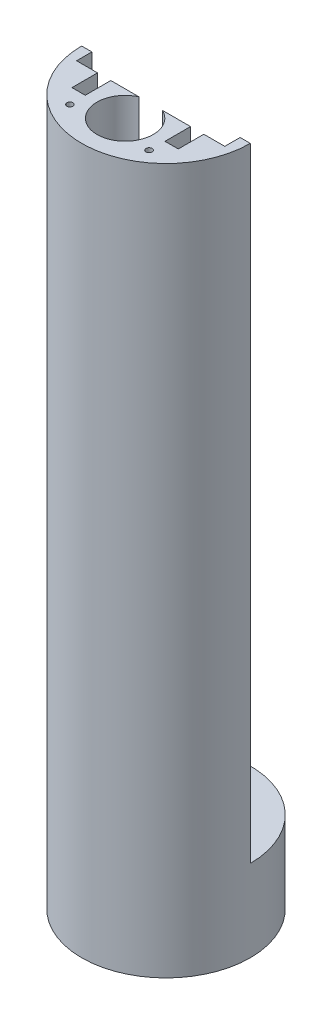
from build123d import *

# Parameters (mm, degrees)
SKETCH_1_R          = 16.5
EXTRUDE_1_DEPTH     = 6
SKETCH_2_R          = 4.25
CUT_EXTRUDE_1_DEPTH = 25.093567606
SKETCH_3_R          = 0.6
CUT_EXTRUDE_2_DEPTH = 3
SKETCH_4_R          = 16.5
SKETCH_4_R_2        = 5.5
EXTRUDE_2_DEPTH     = 10
SKETCH_5_R          = 5.5
EXTRUDE_3_DEPTH     = 122
SKETCH_6_W          = 29
SKETCH_6_H          = 33
SKETCH_6_W_2        = 2
SKETCH_6_H_2        = 13
CUT_EXTRUDE_3_DEPTH = 3
SKETCH_7_W          = 2.6
SKETCH_7_H          = 33
CUT_EXTRUDE_4_DEPTH = 5
SKETCH_8_R          = 0.4
CUT_EXTRUDE_5_DEPTH = 2
SKETCH_9_R          = 0.6
CUT_EXTRUDE_6_DEPTH = 2
SKETCH_10_R         = 0.6
CUT_EXTRUDE_7_DEPTH = 3
SKETCH_11_R         = 0.6
CUT_EXTRUDE_8_DEPTH = 3
SKETCH_12_R         = 1.5
CUT_EXTRUDE_9_DEPTH = 40


with BuildPart() as part:
    # 草图1 → 凸台-拉伸1 (new body)
    with BuildSketch(Plane(origin=(0, 0, 0), x_dir=(1, 0, 0), z_dir=(0, 1, 0))):
        Circle(SKETCH_1_R)
    extrude(amount=EXTRUDE_1_DEPTH)

    # 草图2 → 切除-拉伸1 (cut, through all)
    with BuildSketch(Plane(origin=(0, 6, 0), x_dir=(1, 0, 0), z_dir=(0, 1, 0))):
        with Locations((0, -8)):
            Circle(SKETCH_2_R)
    extrude(amount=-CUT_EXTRUDE_1_DEPTH, mode=Mode.SUBTRACT)

    # 草图3 → 切除-拉伸2 (cut)
    with BuildSketch(Plane.XZ):
        with Locations((-8.485281374, 8.485281374)):
            Circle(SKETCH_3_R)
        with Locations((8.485281374, 8.485281374)):
            Circle(SKETCH_3_R)
        with Locations((8.485281374, -8.485281374)):
            Circle(SKETCH_3_R)
        with Locations((-8.485281374, -8.485281374)):
            Circle(SKETCH_3_R)
    extrude(amount=-CUT_EXTRUDE_2_DEPTH, mode=Mode.SUBTRACT)

    # 草图4 → 凸台-拉伸2 (add)
    with BuildSketch(Plane(origin=(0, 6, 0), x_dir=(1, 0, 0), z_dir=(0, 1, 0))):
        Circle(SKETCH_4_R)
        with Locations((0, -8)):
            Circle(SKETCH_4_R_2, mode=Mode.SUBTRACT)
    extrude(amount=EXTRUDE_2_DEPTH)

    # 草图5 → 凸台-拉伸3 (add)
    with BuildSketch(Plane(origin=(0, 16, 0), x_dir=(1, 0, 0), z_dir=(0, 1, 0))):
        with BuildLine():
            ThreePointArc((-16.5, 0), (0, -16.5), (16.5, 0))
            Line((16.5, 0), (-16.5, 0))
        make_face()
        with Locations((0, -8)):
            Circle(SKETCH_5_R, mode=Mode.SUBTRACT)
    extrude(amount=EXTRUDE_3_DEPTH)

    # 草图6 → 切除-拉伸3 (cut)
    with BuildSketch(Plane(origin=(0, 0, 0), x_dir=(-1, 0, 0), z_dir=(0, 0, -1))):
        with Locations((0, 121.5)):
            Rectangle(SKETCH_6_W, SKETCH_6_H)
        with Locations((0, 98.5)):
            Rectangle(SKETCH_6_W_2, SKETCH_6_H_2)
    extrude(amount=-CUT_EXTRUDE_3_DEPTH, mode=Mode.SUBTRACT)

    # 草图7 → 切除-拉伸4 (cut)
    with BuildSketch(Plane(origin=(0, 0, 3), x_dir=(-1, 0, 0), z_dir=(0, 0, -1))):
        with Locations((9.1, 121.5)):
            Rectangle(SKETCH_7_W, SKETCH_7_H)
        with Locations((-9.1, 121.5)):
            Rectangle(SKETCH_7_W, SKETCH_7_H)
    extrude(amount=-CUT_EXTRUDE_4_DEPTH, mode=Mode.SUBTRACT)

    # 草图8 → 切除-拉伸5 (cut)
    with BuildSketch(Plane(origin=(0, 0, 3), x_dir=(-1, 0, 0), z_dir=(0, 0, -1))):
        with Locations((-12.45, 133)):
            Circle(SKETCH_8_R)
        with Locations((-12.45, 110)):
            Circle(SKETCH_8_R)
        with Locations((12.45, 133)):
            Circle(SKETCH_8_R)
        with Locations((12.45, 110)):
            Circle(SKETCH_8_R)
    extrude(amount=-CUT_EXTRUDE_5_DEPTH, mode=Mode.SUBTRACT)

    # 草图9 → 切除-拉伸6 (cut)
    with BuildSketch(Plane(origin=(0, 0, 0), x_dir=(-1, 0, 0), z_dir=(0, 0, -1))):
        with Locations((0, 70.5)):
            Circle(SKETCH_9_R)
        with Locations((0, 50.5)):
            Circle(SKETCH_9_R)
    extrude(amount=-CUT_EXTRUDE_6_DEPTH, mode=Mode.SUBTRACT)

    # 草图10 → 切除-拉伸7 (cut)
    with BuildSketch(Plane(origin=(0, 0, 0), x_dir=(-1, 0, 0), z_dir=(0, 0, -1))):
        with Locations((-6.5, 90)):
            Circle(SKETCH_10_R)
        with Locations((6.5, 90)):
            Circle(SKETCH_10_R)
        with Locations((6.5, 31)):
            Circle(SKETCH_10_R)
        with Locations((-6.5, 31)):
            Circle(SKETCH_10_R)
    extrude(amount=-CUT_EXTRUDE_7_DEPTH, mode=Mode.SUBTRACT)

    # 草图11 → 切除-拉伸8 (cut)
    with BuildSketch(Plane(origin=(0, 138, 0), x_dir=(1, 0, 0), z_dir=(0, 1, 0))):
        with Locations((7.743281891, -11.058552598)):
            Circle(SKETCH_11_R)
        with Locations((-7.743281891, -11.058552598)):
            Circle(SKETCH_11_R)
    extrude(amount=-CUT_EXTRUDE_8_DEPTH, mode=Mode.SUBTRACT)

    # 草图12 → 切除-拉伸9 (cut)
    with BuildSketch(Plane(origin=(0, 0, 0), x_dir=(-1, 0, 0), z_dir=(0, -1, 0))):
        Circle(SKETCH_12_R)
    extrude(amount=-CUT_EXTRUDE_9_DEPTH, mode=Mode.SUBTRACT)


solid = part.part
